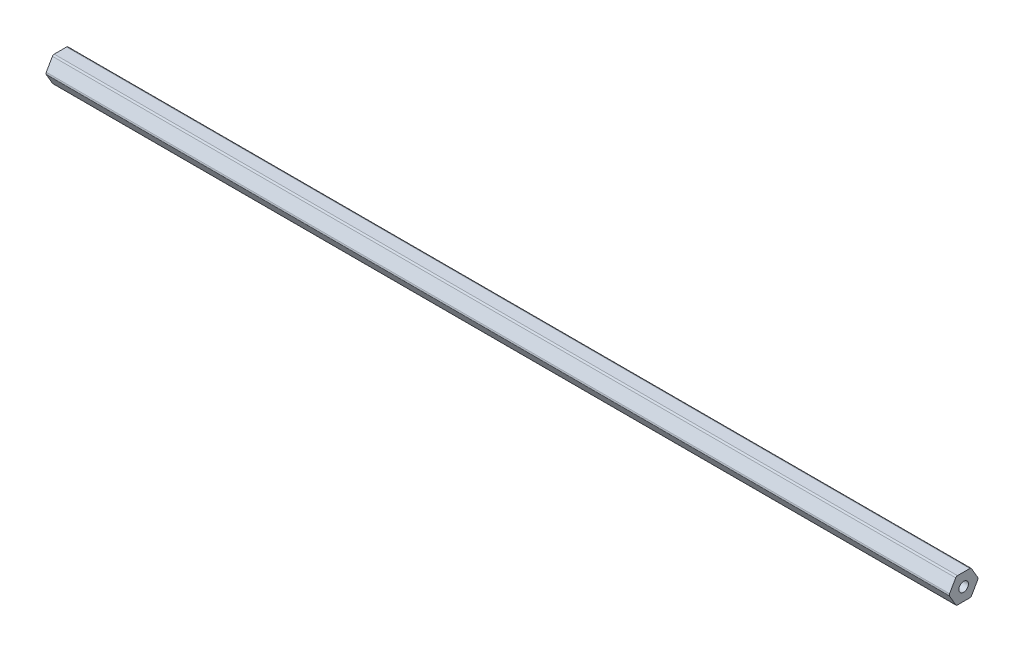
from build123d import *

# Parameters (mm, degrees)
BOSS_EXTRUDE1_DEPTH      = 225.425
BOSS_EXTRUDE1_DEPTH_BACK = 225.425
SKETCH1_R                = 2.38125


with BuildPart() as part:
    # Sketch1 → Boss-Extrude1 (new, two sides: drawn at the far end of the back side and taken through both)
    with BuildSketch(Plane(origin=(0, 0, 0), x_dir=(0, 0, -1), z_dir=(1, 0, 0)).offset(-BOSS_EXTRUDE1_DEPTH_BACK)):
        with BuildLine():
            Line((7.039054482, 0.508), (3.959468146, 5.842))
            ThreePointArc((3.959468146, 5.842), (3.587586336, 6.21388181), (3.079586336, 6.35))
            Line((3.079586336, 6.35), (-3.079586336, 6.35))
            ThreePointArc((-3.079586336, 6.35), (-3.587586336, 6.21388181), (-3.959468146, 5.842))
            Line((-3.959468146, 5.842), (-7.039054482, 0.508))
            ThreePointArc((-7.039054482, 0.508), (-7.175172672, 0), (-7.039054482, -0.508))
            Line((-7.039054482, -0.508), (-3.959468146, -5.842))
            ThreePointArc((-3.959468146, -5.842), (-3.587586336, -6.21388181), (-3.079586336, -6.35))
            Line((-3.079586336, -6.35), (3.079586336, -6.35))
            ThreePointArc((3.079586336, -6.35), (3.587586336, -6.21388181), (3.959468146, -5.842))
            Line((3.959468146, -5.842), (7.039054482, -0.508))
            ThreePointArc((7.039054482, -0.508), (7.175172672, 0), (7.039054482, 0.508))
        make_face()
        Circle(SKETCH1_R, mode=Mode.SUBTRACT)
    extrude(amount=BOSS_EXTRUDE1_DEPTH + BOSS_EXTRUDE1_DEPTH_BACK)


solid = part.part
